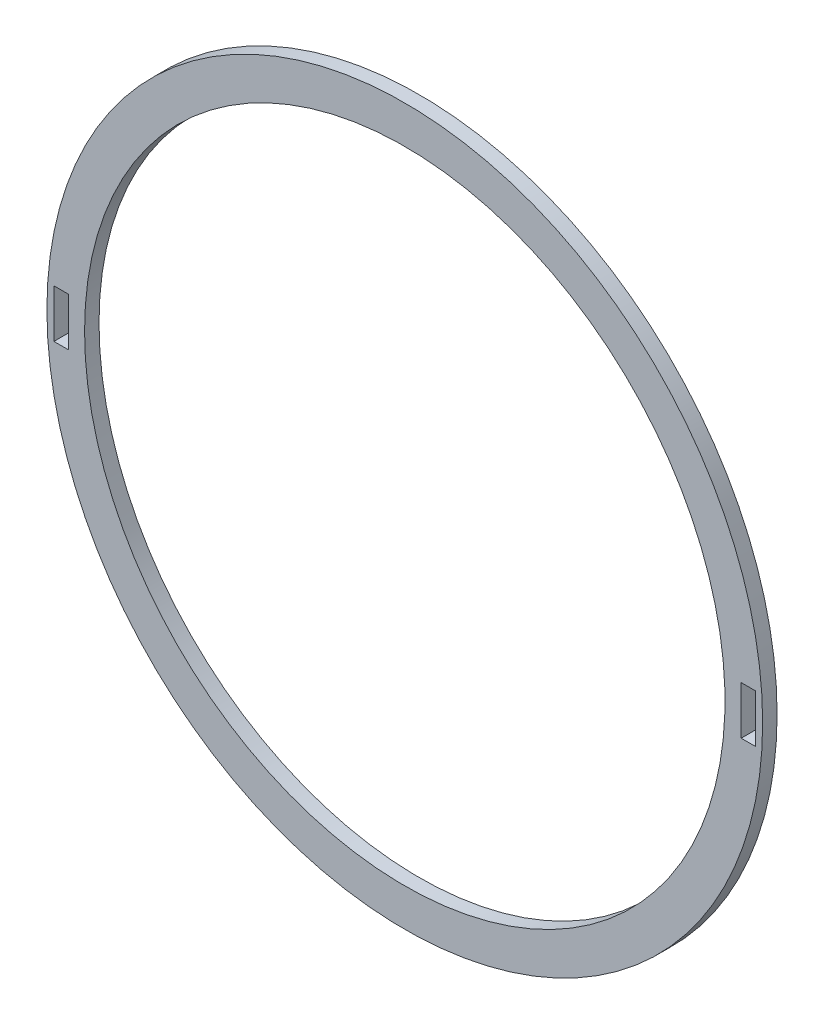
from build123d import *

# Parameters (mm, degrees)
SKETCH1_R           = 37.749892726
SKETCH1_R_2         = 33.776867373
SKETCH1_W           = 1.524
SKETCH1_H           = 5.08
BOSS_EXTRUDE1_DEPTH = 1.524


with BuildPart() as part:
    # Sketch1 → Boss-Extrude1 (new body)
    with BuildSketch(Plane.XY):
        with Locations((0, 25.14119341)):
            Circle(SKETCH1_R)
        with Locations((0, 25.14119341)):
            Circle(SKETCH1_R_2, mode=Mode.SUBTRACT)
        with Locations((36.247543911, 25.14119341)):
            Rectangle(SKETCH1_W, SKETCH1_H, mode=Mode.SUBTRACT)
        with Locations((-36.247543911, 25.14119341)):
            Rectangle(SKETCH1_W, SKETCH1_H, mode=Mode.SUBTRACT)
    extrude(amount=BOSS_EXTRUDE1_DEPTH)


solid = part.part
